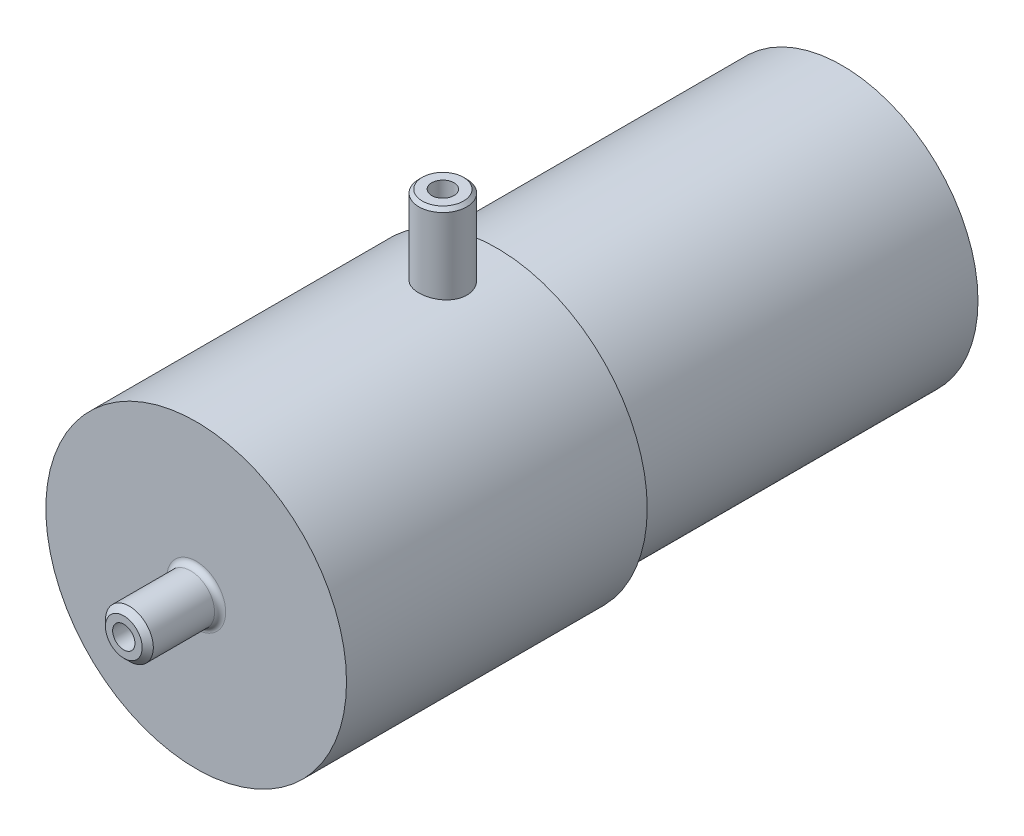
from build123d import *
from build123d.topology import SkipClean

# Parameters (mm, degrees)
CROQUIS1_R                               = 12.2
SALIENTE_EXTRUIR1_DEPTH                  = 31
CROQUIS2_R                               = 13.5
SALIENTE_EXTRUIR2_DEPTH                  = 27
CROQUIS3_R                               = 2.15
CROQUIS3_R_2                             = 1
SALIENTE_EXTRUIR3_DEPTH                  = 6.5
CHAFL_N2_SIZE                            = 0.5
REDONDEO1_R                              = 0.5
CROQUIS5_R                               = 2.15
CROQUIS5_R_2                             = 1
SALIENTE_EXTRUIR4_DEPTH                  = 7
SALIENTE_EXTRUIR4_DIRECTION_2_REACH      = 73.214
SALIENTE_EXTRUIR4_DIRECTION_2_END_RADIUS = 13.5
CHAFL_N3_SIZE                            = 0.3
CROQUIS6_R                               = 3
SALIENTE_EXTRUIR5_DEPTH                  = 2
REDONDEO2_R                              = 1


with BuildPart() as part:
    # Croquis1 → Saliente-Extruir1 (new body)
    with BuildSketch(Plane.XY):
        Circle(CROQUIS1_R)
    extrude(amount=SALIENTE_EXTRUIR1_DEPTH)

    # Croquis2 → Saliente-Extruir2 (add)
    with BuildSketch(Plane.XY.offset(31)):
        Circle(CROQUIS2_R)
    extrude(amount=SALIENTE_EXTRUIR2_DEPTH)

    # Croquis3 → Saliente-Extruir3 (add)
    with BuildSketch(Plane.XY.offset(58)):
        Circle(CROQUIS3_R)
        Circle(CROQUIS3_R_2, mode=Mode.SUBTRACT)
    extrude(amount=SALIENTE_EXTRUIR3_DEPTH)

    # Chaflán2
    chafl_n2_edges = [part.edges().sort_by_distance(p)[0] for p in [
        (-2.15, 0, 64.5),
    ]]
    chamfer(chafl_n2_edges, length=CHAFL_N2_SIZE)

    # Redondeo1
    redondeo1_edges = [part.edges().sort_by_distance(p)[0] for p in [
        (-2.15, 0, 58),
    ]]
    fillet(redondeo1_edges, radius=REDONDEO1_R)

    # Croquis5 → Saliente-Extruir4 (add)
    with BuildSketch(Plane(origin=(0, 13.5, 0), x_dir=(1, 0, 0), z_dir=(0, 1, 0))):
        with Locations((0, -35.85)):
            Circle(CROQUIS5_R)
        with Locations((0, -35.85)):
            Circle(CROQUIS5_R_2, mode=Mode.SUBTRACT)
    extrude(amount=SALIENTE_EXTRUIR4_DEPTH)

    # Saliente-Extruir4 direction 2: up to this cylinder (the profile starts outside it)
    with SkipClean():  # the faces are left unmerged after this step: merging them gives an invalid solid
        saliente_extruir4_direction_2_end = Plane(origin=(0, 0, 35.85), z_dir=(0, 0, -1)) * Cylinder(SALIENTE_EXTRUIR4_DIRECTION_2_END_RADIUS, 174.428, mode=Mode.PRIVATE)
        # Croquis5 → Saliente-Extruir4 direction 2 (add, up to the surface)
        with BuildSketch(Plane(origin=(0, 13.5, 0), x_dir=(1, 0, 0), z_dir=(0, 1, 0)), mode=Mode.PRIVATE) as saliente_extruir4_direction_2_sk1:
            with Locations((0, -35.85)):
                Circle(CROQUIS5_R)
            with Locations((0, -35.85)):
                Circle(CROQUIS5_R_2, mode=Mode.SUBTRACT)
        saliente_extruir4_direction_2_tool1 = extrude(saliente_extruir4_direction_2_sk1.sketch, amount=-SALIENTE_EXTRUIR4_DIRECTION_2_REACH, mode=Mode.PRIVATE) - saliente_extruir4_direction_2_end
        add(saliente_extruir4_direction_2_tool1.solids().sort_by_distance((-2.089189, 13.5, 35.85))[0])
        add(saliente_extruir4_direction_2_tool1.solids().sort_by_distance((-2.089189, 13.5, 35.85))[1])

    # Chaflán3
    chafl_n3_edges = [part.edges().sort_by_distance(p)[0] for p in [
        (-2.15, 20.5, 35.85),
    ]]
    chamfer(chafl_n3_edges, length=CHAFL_N3_SIZE)

    # Croquis6 → Saliente-Extruir5 (add)
    with BuildSketch(Plane(origin=(0, 0, 0), x_dir=(-1, 0, 0), z_dir=(0, 0, -1))):
        Circle(CROQUIS6_R)
    extrude(amount=SALIENTE_EXTRUIR5_DEPTH)

    # Redondeo2
    redondeo2_edges = [part.edges().sort_by_distance(p)[0] for p in [
        (3, 0, -2),
    ]]
    fillet(redondeo2_edges, radius=REDONDEO2_R)


solid = part.part
